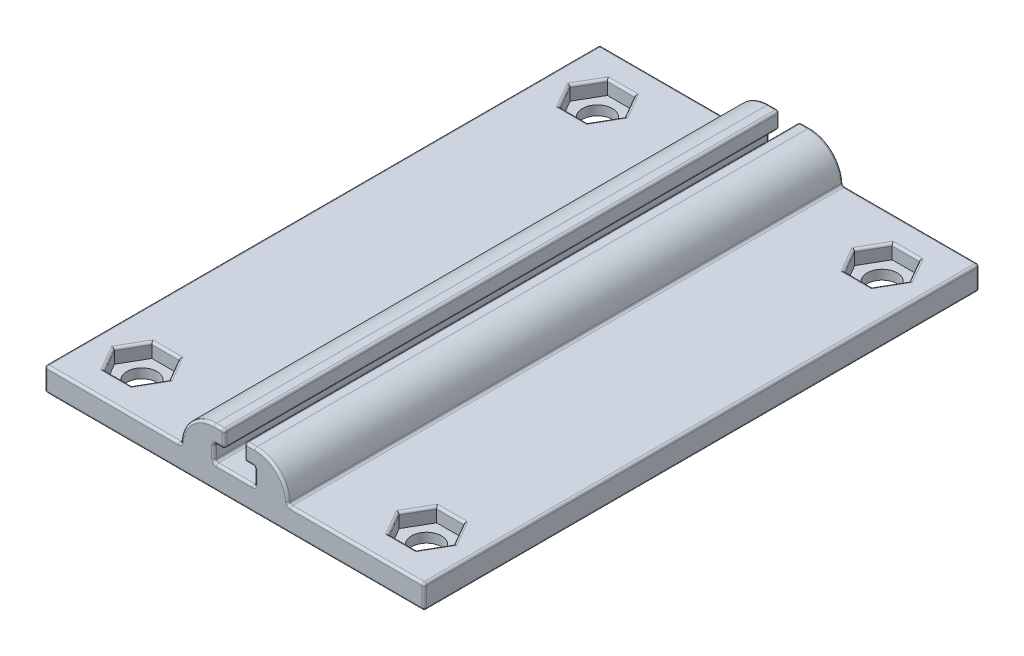
from build123d import *

# Parameters (mm, degrees)
BOSS_EXTRUDE1_DEPTH      = 58.5
BOSS_EXTRUDE1_DEPTH_BACK = 58.5
SKETCH2_R                = 3.15
CUT_EXTRUDE1_DEPTH       = 58.5
FILLET1_R                = 0.5
CUT_EXTRUDE2_DEPTH       = 3
LPATTERN1_COUNT          = 2
LPATTERN1_PITCH          = 60
FILLET2_R                = 0.5


with BuildPart() as part:
    # Sketch1 → Boss-Extrude1 (new, two sides: drawn at the far end of the back side and taken through both)
    with BuildSketch(Plane.XY.offset(-BOSS_EXTRUDE1_DEPTH_BACK)):
        with BuildLine():
            Line((-40, -2.5), (40, -2.5))
            Line((40, -2.5), (40, 2.5))
            Line((40, 2.5), (11.3, 2.5))
            ThreePointArc((11.3, 2.5), (9.249747468, 7.449747468), (4.3, 9.5))
            Line((4.3, 9.5), (2.1, 9.5))
            Line((2.1, 9.5), (2.1, 6))
            Line((2.1, 6), (4.3, 6))
            Line((4.3, 6), (4.3, 2.5))
            Line((4.3, 2.5), (-4.3, 2.5))
            Line((-4.3, 2.5), (-4.3, 6))
            Line((-4.3, 6), (-2.1, 6))
            Line((-2.1, 6), (-2.1, 9.5))
            Line((-2.1, 9.5), (-4.3, 9.5))
            ThreePointArc((-4.3, 9.5), (-9.249747468, 7.449747468), (-11.3, 2.5))
            Line((-11.3, 2.5), (-40, 2.5))
            Line((-40, 2.5), (-40, -2.5))
        make_face()
    extrude(amount=BOSS_EXTRUDE1_DEPTH + BOSS_EXTRUDE1_DEPTH_BACK)

    # Sketch2 → Cut-Extrude1 (cut)
    with BuildSketch(Plane.XZ.offset(2.5)):
        with Locations((-30, 48)):
            Circle(SKETCH2_R)
        with Locations((30, 48)):
            Circle(SKETCH2_R)
        with Locations((30, -48)):
            Circle(SKETCH2_R)
        with Locations((-30, -48)):
            Circle(SKETCH2_R)
    extrude(amount=-CUT_EXTRUDE1_DEPTH, mode=Mode.SUBTRACT)

    # Fillet1
    fillet1_edges = [part.edges().sort_by_distance(p)[0] for p in [
        (40, -2.5, 0),
        (-40, -2.5, 0),
        (-4.3, 6, 0),
        (-2.1, 6, 0),
        (-2.1, 9.5, 0),
        (2.1, 9.5, 0),
        (2.1, 6, 0),
        (4.3, 6, 0),
        (4.3, 2.5, 0),
        (-4.3, 2.5, 0),
        (-3.2, 6, -58.5),
        (-2.1, 7.75, -58.5),
        (-3.2, 9.5, -58.5),
        (-9.249747468, 7.449747468, -58.5),
        (-40, 0, -58.5),
        (0, -2.5, -58.5),
        (40, 0, -58.5),
        (9.249747468, 7.449747468, -58.5),
        (3.2, 9.5, -58.5),
        (2.1, 7.75, -58.5),
        (3.2, 6, -58.5),
        (4.3, 4.25, -58.5),
        (0, 2.5, -58.5),
        (-4.3, 4.25, -58.5),
        (0, 2.5, 58.5),
        (4.3, 4.25, 58.5),
        (3.2, 6, 58.5),
        (2.1, 7.75, 58.5),
        (3.2, 9.5, 58.5),
        (9.249747468, 7.449747468, 58.5),
        (40, 0, 58.5),
        (0, -2.5, 58.5),
        (-40, 0, 58.5),
        (-9.249747468, 7.449747468, 58.5),
        (-3.2, 9.5, 58.5),
        (-2.1, 7.75, 58.5),
        (-3.2, 6, 58.5),
        (-4.3, 4.25, 58.5),
        (-25.65, 2.5, -58.5),
        (-11.3, 2.5, 0),
        (-25.65, 2.5, 58.5),
        (-40, 2.5, 0),
        (-33.15, 2.5, -48),
        (-33.15, 2.5, 48),
        (25.65, 2.5, -58.5),
        (40, 2.5, 0),
        (25.65, 2.5, 58.5),
        (11.3, 2.5, 0),
        (26.85, 2.5, 48),
        (26.85, 2.5, -48),
    ]]
    fillet(fillet1_edges, radius=FILLET1_R)

    # Sketch3 → Cut-Extrude2 (cut)
    with BuildSketch(Plane(origin=(0, 2.5, 0), x_dir=(1, 0, 0), z_dir=(0, 1, 0))):
        Polygon((-24.226497308, 48), (-27.113248654, 53), (-32.886751346, 53), (-35.773502692, 48), (-32.886751346, 43), (-27.113248654, 43), align=None)
        Polygon((-24.226497308, -48), (-27.113248654, -43), (-32.886751346, -43), (-35.773502692, -48), (-32.886751346, -53), (-27.113248654, -53), align=None)
    cut_extrude2 = extrude(amount=-CUT_EXTRUDE2_DEPTH, mode=Mode.SUBTRACT)

    # LPattern1: Cut-Extrude2 ×2
    with Locations(*[(i * LPATTERN1_PITCH, 0, 0) for i in range(1, LPATTERN1_COUNT)]):
        add(cut_extrude2, mode=Mode.SUBTRACT)

    # Fillet2
    fillet2_edges = [part.edges().sort_by_distance(p)[0] for p in [
        (30, 2.5, 43),
        (25.669872981, 2.5, 45.5),
        (25.669872981, 2.5, 50.5),
        (30, 2.5, 53),
        (34.330127019, 2.5, 50.5),
        (34.330127019, 2.5, 45.5),
        (30, 2.5, -53),
        (25.669872981, 2.5, -50.5),
        (25.669872981, 2.5, -45.5),
        (30, 2.5, -43),
        (34.330127019, 2.5, -45.5),
        (34.330127019, 2.5, -50.5),
        (-30, 2.5, 43),
        (-34.330127019, 2.5, 45.5),
        (-34.330127019, 2.5, 50.5),
        (-30, 2.5, 53),
        (-25.669872981, 2.5, 50.5),
        (-25.669872981, 2.5, 45.5),
        (-30, 2.5, -53),
        (-34.330127019, 2.5, -50.5),
        (-34.330127019, 2.5, -45.5),
        (-30, 2.5, -43),
        (-25.669872981, 2.5, -45.5),
        (-25.669872981, 2.5, -50.5),
    ]]
    fillet(fillet2_edges, radius=FILLET2_R)


solid = part.part
